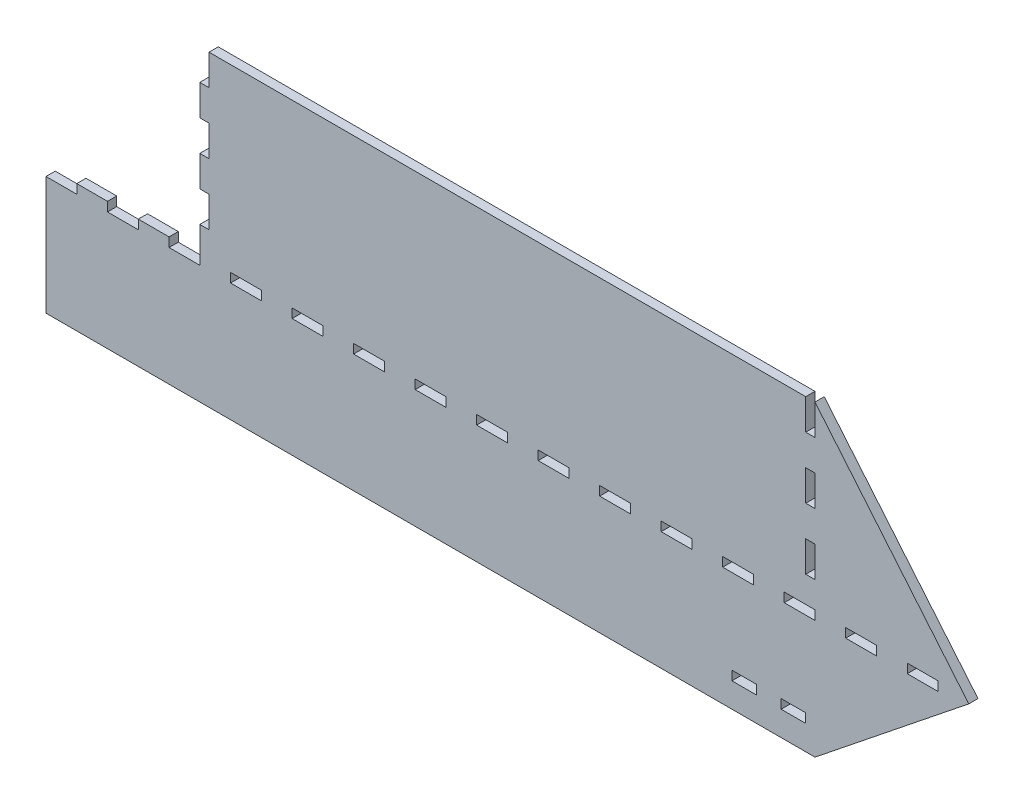
from build123d import *

# Parameters (mm, degrees)
SKETCH1_W           = 10
SKETCH1_H           = 3
SKETCH1_W_2         = 8
SKETCH1_W_3         = 3
SKETCH1_H_2         = 10
BOSS_EXTRUDE1_DEPTH = 3


with BuildPart() as part:
    # Sketch1 → Boss-Extrude1 (new body)
    with BuildSketch(Plane.XY):
        Polygon((-113.876526387, -53.728350242), (-113.876526387, -92.228350242), (136.123473613, -92.228350242), (186.123473613, -52.228350242), (136.123473613, 7.771649758), (136.123473613, -2.228350242), (133.123473613, -2.228350242), (133.123473613, 7.771649758), (-60.876526387, 7.771649758), (-60.876526387, -2.228350242), (-63.876526387, -2.228350242), (-63.876526387, -12.228350242), (-60.876526387, -12.228350242), (-60.876526387, -22.228350242), (-63.876526387, -22.228350242), (-63.876526387, -32.228350242), (-60.876526387, -32.228350242), (-60.876526387, -42.228350242), (-63.876526387, -42.228350242), (-63.876526387, -50.728350242), (-63.876526387, -53.728350242), (-73.876526387, -53.728350242), (-73.876526387, -50.728350242), (-83.876526387, -50.728350242), (-83.876526387, -53.728350242), (-93.876526387, -53.728350242), (-93.876526387, -50.728350242), (-103.876526387, -50.728350242), (-103.876526387, -53.728350242), align=None)
        with Locations((-48.876526387, -52.228350242)):
            Rectangle(SKETCH1_W, SKETCH1_H, mode=Mode.SUBTRACT)
        with Locations((-28.876526387, -52.228350242)):
            Rectangle(SKETCH1_W, SKETCH1_H, mode=Mode.SUBTRACT)
        with Locations((-8.876526387, -52.228350242)):
            Rectangle(SKETCH1_W, SKETCH1_H, mode=Mode.SUBTRACT)
        with Locations((11.123473613, -52.228350242)):
            Rectangle(SKETCH1_W, SKETCH1_H, mode=Mode.SUBTRACT)
        with Locations((31.123473613, -52.228350242)):
            Rectangle(SKETCH1_W, SKETCH1_H, mode=Mode.SUBTRACT)
        with Locations((113.123473613, -82.728350242)):
            Rectangle(SKETCH1_W_2, SKETCH1_H, mode=Mode.SUBTRACT)
        with Locations((129.123473613, -82.728350242)):
            Rectangle(SKETCH1_W_2, SKETCH1_H, mode=Mode.SUBTRACT)
        with Locations((51.123473613, -52.228350242)):
            Rectangle(SKETCH1_W, SKETCH1_H, mode=Mode.SUBTRACT)
        with Locations((71.123473613, -52.228350242)):
            Rectangle(SKETCH1_W, SKETCH1_H, mode=Mode.SUBTRACT)
        with Locations((91.123473613, -52.228350242)):
            Rectangle(SKETCH1_W, SKETCH1_H, mode=Mode.SUBTRACT)
        with Locations((111.123473613, -52.228350242)):
            Rectangle(SKETCH1_W, SKETCH1_H, mode=Mode.SUBTRACT)
        with Locations((131.123473613, -52.228350242)):
            Rectangle(SKETCH1_W, SKETCH1_H, mode=Mode.SUBTRACT)
        with Locations((151.123473613, -52.228350242)):
            Rectangle(SKETCH1_W, SKETCH1_H, mode=Mode.SUBTRACT)
        with Locations((171.123473613, -52.228350242)):
            Rectangle(SKETCH1_W, SKETCH1_H, mode=Mode.SUBTRACT)
        with Locations((134.623473613, -37.228350242)):
            Rectangle(SKETCH1_W_3, SKETCH1_H_2, mode=Mode.SUBTRACT)
        with Locations((134.623473613, -17.228350242)):
            Rectangle(SKETCH1_W_3, SKETCH1_H_2, mode=Mode.SUBTRACT)
    extrude(amount=BOSS_EXTRUDE1_DEPTH)


solid = part.part
